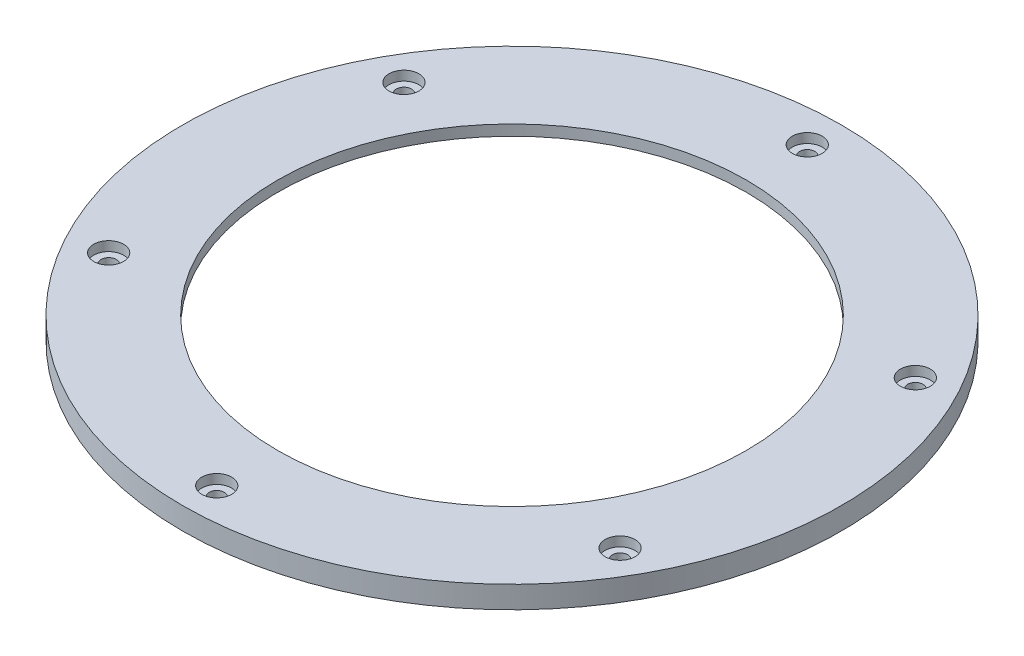
from build123d import *

# Parameters (mm, degrees)
SKETCH2_R                 = 86.5
SKETCH2_R_2               = 61.5
SKETCH2_R_3               = 2
BOSS_EXTRUDE1_DEPTH       = 5.8
SKETCH3_R                 = 70
SKETCH3_R_2               = 61.5
CUT_EXTRUDE1_DEPTH        = 3
ADVANCEDHOLE1_START       = 3.3
ADVANCEDHOLE1_OUTLINE_R   = 3.925
ADVANCEDHOLE1_OUTLINE_R_2 = 2
ADVANCEDHOLE1_DEPTH       = 2.5
CIRPATTERN1_COUNT         = 6


# Read off the part's stored shape, not the designer's step: AdvancedHole1
with BuildPart() as part:
    # Sketch2 → Boss-Extrude1 (new body)
    with BuildSketch(Plane(origin=(0, 0, 0), x_dir=(1, 0, 0), z_dir=(0, 1, 0))):
        with Locations(Location((0, 0, 0), (0, 0, 270))):
            Circle(SKETCH2_R)
        with Locations(Location((0, 0, 0), (0, 0, 270))):
            Circle(SKETCH2_R_2, mode=Mode.SUBTRACT)
        with Locations(Location((0, 77.5, 0), (0, 0, 270))):
            Circle(SKETCH2_R_3, mode=Mode.SUBTRACT)
        with Locations(Location((67.116968793, 38.75, 0), (0, 0, 270))):
            Circle(SKETCH2_R_3, mode=Mode.SUBTRACT)
        with Locations(Location((67.116968793, -38.75, 0), (0, 0, 270))):
            Circle(SKETCH2_R_3, mode=Mode.SUBTRACT)
        with Locations(Location((0, -77.5, 0), (0, 0, 270))):
            Circle(SKETCH2_R_3, mode=Mode.SUBTRACT)
        with Locations(Location((-67.116968793, -38.75, 0), (0, 0, 270))):
            Circle(SKETCH2_R_3, mode=Mode.SUBTRACT)
        with Locations(Location((-67.116968793, 38.75, 0), (0, 0, 270))):
            Circle(SKETCH2_R_3, mode=Mode.SUBTRACT)
    extrude(amount=BOSS_EXTRUDE1_DEPTH)

    # Sketch3 → Cut-Extrude1 (cut)
    with BuildSketch(Plane.XZ):
        with Locations(Location((0, 0, 0), (0, 0, 270))):
            Circle(SKETCH3_R)
        with Locations(Location((0, 0, 0), (0, 0, 270))):
            Circle(SKETCH3_R_2, mode=Mode.SUBTRACT)
    extrude(amount=-CUT_EXTRUDE1_DEPTH, mode=Mode.SUBTRACT)

    # AdvancedHole1 outline → AdvancedHole1 (cut)
    with BuildSketch(Plane(origin=(0, 0, 0), x_dir=(1, 0, 0), z_dir=(0, 1, 0)).offset(ADVANCEDHOLE1_START)):
        with Locations((-67.116968793, -38.75)):
            Circle(ADVANCEDHOLE1_OUTLINE_R)
        with Locations((-67.116968793, -38.75)):
            Circle(ADVANCEDHOLE1_OUTLINE_R_2, mode=Mode.SUBTRACT)
    advancedhole1 = extrude(amount=ADVANCEDHOLE1_DEPTH, mode=Mode.SUBTRACT)

    # CirPattern1: AdvancedHole1 ×6 about axis
    cirpattern1_axis = Axis((0, 0, 0), (0, 1, 0))
    for i in range(1, CIRPATTERN1_COUNT):
        add(advancedhole1.rotate(cirpattern1_axis, i * 360 / CIRPATTERN1_COUNT), mode=Mode.SUBTRACT)


solid = part.part
